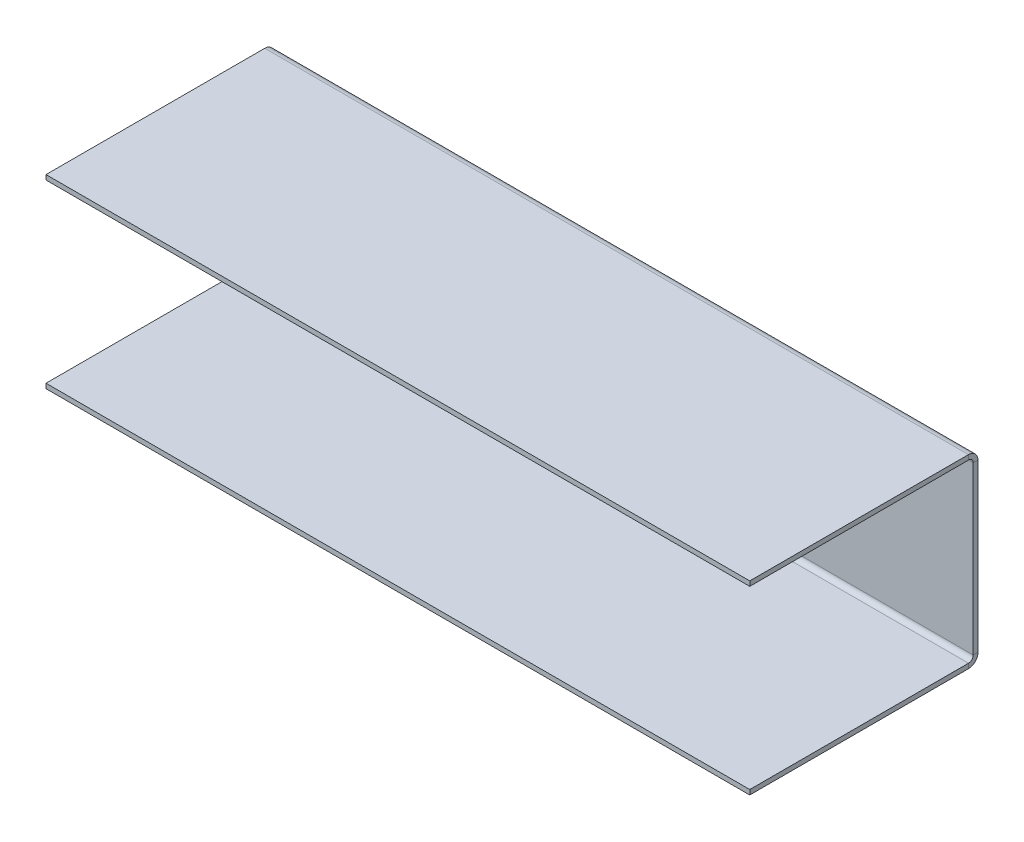
from build123d import *

# Parameters (mm, degrees)
BASE_FLANGE1_DEPTH = 469.9


# Sheet-metal steps are written as plain solids
with BuildPart() as part:
    # Sketch1 → Base-Flange1 (new body)
    with BuildSketch(Plane(origin=(0, 0, 0), x_dir=(0, 0, -1), z_dir=(1, 0, 0))):
        with BuildLine():
            Line((0, 0), (146.05, 0))
            ThreePointArc((146.05, 0), (150.540128061, 1.859871939), (152.4, 6.35))
            Line((152.4, 6.35), (152.4, 117.475))
            ThreePointArc((152.4, 117.475), (150.540128061, 121.965128061), (146.05, 123.825))
            Line((146.05, 123.825), (0, 123.825))
            Line((0, 123.825), (0, 120.65))
            Line((0, 120.65), (146.05, 120.65))
            ThreePointArc((146.05, 120.65), (148.29506403, 119.72006403), (149.225, 117.475))
            Line((149.225, 117.475), (149.225, 6.35))
            ThreePointArc((149.225, 6.35), (148.29506403, 4.10493597), (146.05, 3.175))
            Line((146.05, 3.175), (0, 3.175))
            Line((0, 3.175), (0, 0))
        make_face()
    extrude(amount=BASE_FLANGE1_DEPTH)


solid = part.part
